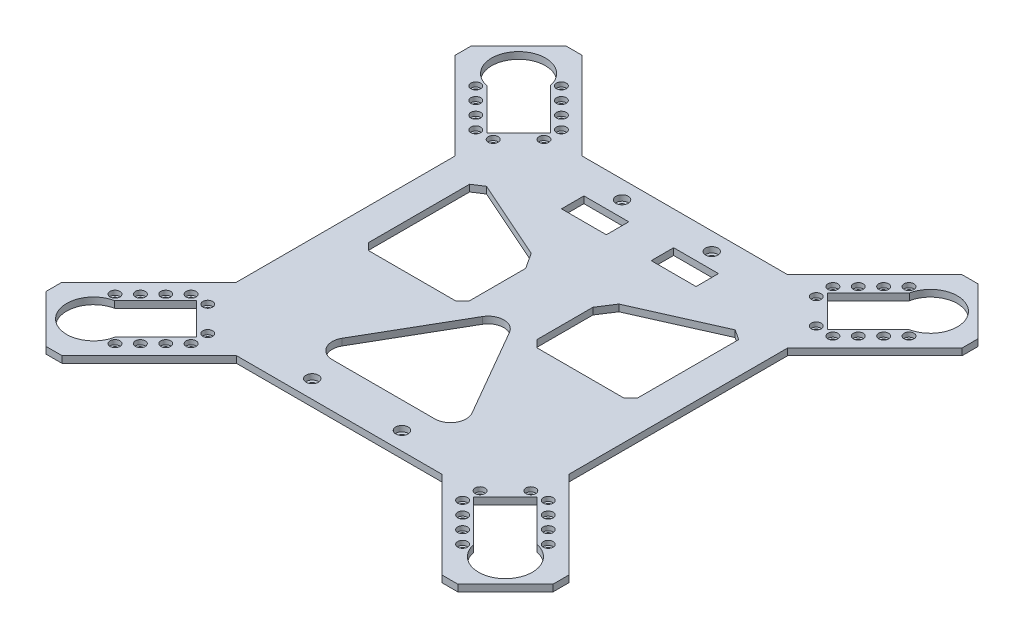
from build123d import *

# Parameters (mm, degrees)
BOSS_EXTRUDE1_DEPTH              = 3
CUT_EXTRUDE1_DEPTH               = 10
CUT_EXTRUDE2_DEPTH               = 10
CBORE_FOR_M2_SHCS1_D             = 2.4
CBORE_FOR_M2_SHCS1_CBORE_D       = 4.4
CBORE_FOR_M2_SHCS1_CBORE_DEPTH   = 2
MIRROR2_COPY_1_D                 = 2.4
MIRROR2_COPY_1_CBORE_D           = 4.4
MIRROR2_COPY_1_CBORE_DEPTH       = 2
SKETCH8_W                        = 20
SKETCH8_H                        = 10
SKETCH8_W_2                      = 60
CUT_EXTRUDE3_DEPTH               = 10
CBORE_FOR_M2_5_SHCS1_D           = 2.9
CBORE_FOR_M2_5_SHCS1_CBORE_D     = 5.5
CBORE_FOR_M2_5_SHCS1_CBORE_DEPTH = 2.5
CORTAR_EXTRUIR1_DEPTH            = 848
CORTAR_EXTRUIR1_DEPTH_BACK       = 962
CROQUIS1_W                       = 356.551899134
CROQUIS1_H                       = 194.800027737
CROQUIS3_W                       = 148.284271248
CROQUIS3_H                       = 70
SALIENTE_EXTRUIR3_DEPTH          = 3
SALIENTE_EXTRUIR4_DEPTH          = 3
CORTAR_EXTRUIR3_DEPTH            = 3
CROQUIS10_R                      = 1.2
CORTAR_EXTRUIR13_DEPTH           = 3
CROQUIS22_R                      = 2.2
CORTAR_EXTRUIR14_DEPTH           = 2
CORTAR_EXTRUIR16_DEPTH           = 243
CORTAR_EXTRUIR16_DEPTH_BACK      = 68
CROQUIS25_R                      = 1.2
CORTAR_EXTRUIR17_DEPTH           = 3
CROQUIS26_R                      = 1.2
CORTAR_EXTRUIR18_DEPTH           = 3
CROQUIS27_R                      = 2.2
CORTAR_EXTRUIR19_DEPTH           = 2
CROQUIS29_R                      = 1.2
CORTAR_EXTRUIR20_DEPTH           = 3
CROQUIS30_R                      = 2.2
CORTAR_EXTRUIR21_DEPTH           = 2
SALIENTE_EXTRUIR5_DEPTH          = 3
CORTAR_EXTRUIR22_DEPTH           = 3
CROQUIS34_R                      = 1.2
CORTAR_EXTRUIR24_DEPTH           = 3
CROQUIS35_R                      = 2.2
CORTAR_EXTRUIR25_DEPTH           = 2
CROQUIS37_R                      = 1.2
CORTAR_EXTRUIR26_DEPTH           = 3
CROQUIS38_R                      = 2.2
CORTAR_EXTRUIR27_DEPTH           = 2
CROQUIS39_R                      = 1.2
CORTAR_EXTRUIR28_DEPTH           = 3
CROQUIS40_R                      = 2.2
CORTAR_EXTRUIR30_DEPTH           = 2
CROQUIS47_R                      = 1.45
CORTAR_EXTRUIR32_DEPTH           = 3
CROQUIS48_R                      = 2.75
CORTAR_EXTRUIR33_DEPTH           = 2.5


with BuildPart() as part:
    # Sketch1 → Boss-Extrude1 (new body)
    with BuildSketch(Plane(origin=(0, 0, 0), x_dir=(1, 0, 0), z_dir=(0, 1, 0))):
        Polygon((-74.142135624, -30), (-74.142135624, -85.857864376), (-113.033008589, -124.748737342), (-113.033008589, -131.819805153), (-91.819805153, -153.033008589), (-84.748737342, -153.033008589), (-45.857864376, -114.142135624), (45.857864376, -114.142135624), (84.748737342, -153.033008589), (91.819805153, -153.033008589), (113.033008589, -131.819805153), (113.033008589, -124.748737342), (74.142135624, -85.857864376), (74.142135624, -30), (90.606601718, -20), (145.606601718, -20), (150.606601718, -15), (150.606601718, 15), (145.606601718, 20), (90.606601718, 20), (74.142135624, 30), (74.142135624, 85.857864376), (113.033008589, 124.748737342), (113.033008589, 131.819805153), (91.819805153, 153.033008589), (84.748737342, 153.033008589), (45.857864376, 114.142135624), (-45.857864376, 114.142135624), (-84.748737342, 153.033008589), (-91.819805153, 153.033008589), (-113.033008589, 131.819805153), (-113.033008589, 124.748737342), (-74.142135624, 85.857864376), (-74.142135624, 30), (-90.606601718, 20), (-145.606601718, 20), (-150.606601718, 15), (-150.606601718, -15), (-145.606601718, -20), (-90.606601718, -20), align=None)
    extrude(amount=BOSS_EXTRUDE1_DEPTH)

    # Sketch2 → Cut-Extrude1 (cut)
    with BuildSketch(Plane(origin=(0, 3, 0), x_dir=(1, 0, 0), z_dir=(0, 1, 0))):
        with BuildLine():
            Line((103.106601718, 10), (128.973352137, 10))
            ThreePointArc((128.973352137, 10), (147.606601718, 0), (128.973352137, -10))
            Line((128.973352137, -10), (103.106601718, -10))
            Line((103.106601718, -10), (103.106601718, 10))
        make_face()
        with BuildLine():
            Line((-103.106601718, -10), (-128.973352137, -10))
            ThreePointArc((-128.973352137, -10), (-147.606601718, 0), (-128.973352137, 10))
            Line((-128.973352137, 10), (-103.106601718, 10))
            Line((-103.106601718, 10), (-103.106601718, -10))
        make_face()
    extrude(amount=-CUT_EXTRUDE1_DEPTH, mode=Mode.SUBTRACT)

    # Sketch4 → Cut-Extrude2 (cut)
    with BuildSketch(Plane(origin=(0, 3, 0), x_dir=(1, 0, 0), z_dir=(0, 1, 0))):
        with BuildLine():
            Line((-75.909902577, 101.767766953), (-61.767766953, 115.909902577))
            Line((-61.767766953, 115.909902577), (-80.058321582, 134.200457205))
            ThreePointArc((-80.058321582, 134.200457205), (-100.305086528, 140.305086528), (-94.200457205, 120.058321582))
            Line((-94.200457205, 120.058321582), (-75.909902577, 101.767766953))
        make_face()
        with BuildLine():
            Line((94.200457205, 120.058321582), (75.909902577, 101.767766953))
            Line((75.909902577, 101.767766953), (61.767766953, 115.909902577))
            Line((61.767766953, 115.909902577), (80.058321582, 134.200457205))
            ThreePointArc((80.058321582, 134.200457205), (100.305086528, 140.305086528), (94.200457205, 120.058321582))
        make_face()
        with BuildLine():
            Line((75.909902577, -101.767766953), (61.767766953, -115.909902577))
            Line((61.767766953, -115.909902577), (80.058321582, -134.200457205))
            ThreePointArc((80.058321582, -134.200457205), (100.305086528, -140.305086528), (94.200457205, -120.058321582))
            Line((94.200457205, -120.058321582), (75.909902577, -101.767766953))
        make_face()
        with BuildLine():
            Line((-94.200457205, -120.058321582), (-75.909902577, -101.767766953))
            Line((-75.909902577, -101.767766953), (-61.767766953, -115.909902577))
            Line((-61.767766953, -115.909902577), (-80.058321582, -134.200457205))
            ThreePointArc((-80.058321582, -134.200457205), (-100.305086528, -140.305086528), (-94.200457205, -120.058321582))
        make_face()
    extrude(amount=-CUT_EXTRUDE2_DEPTH, mode=Mode.SUBTRACT)

    # CBORE for M2 SHCS1 (through all)
    with Locations(Plane(origin=(0, 3, 0), x_dir=(-1, 0, 0), z_dir=(0, 1, 0))):
        with Locations((-104.856601718, -13.5), (-112.856601718, -13.5), (-120.856601718, -13.5), (-128.856601718, -13.5), (-60.530330086, -119.622213178), (-66.187184335, -125.279067427), (-71.844038585, -130.935921677), (-77.500892834, -136.592775926), (-79.622213178, -100.530330086), (-85.279067427, -106.187184335), (-90.935921677, -111.844038585), (-96.592775926, -117.500892834), (-104.856601718, 13.5), (-112.856601718, 13.5), (-120.856601718, 13.5), (-128.856601718, 13.5), (-60.707106781, -112.02081528), (-72.02081528, -100.707106781), (-99.606601718, -8), (-99.606601718, 8)):
            cbore_for_m2_shcs1 = CounterBoreHole(CBORE_FOR_M2_SHCS1_D / 2, CBORE_FOR_M2_SHCS1_CBORE_D / 2, CBORE_FOR_M2_SHCS1_CBORE_DEPTH)

    # Mirror1: CBORE for M2 SHCS1 across plane
    add(cbore_for_m2_shcs1.mirror(Plane(origin=(0, 0, 0), x_dir=(0, 0, 1), z_dir=(1, 0, 0))), mode=Mode.SUBTRACT)

    # Mirror2: CBORE for M2 SHCS1 across plane
    add(cbore_for_m2_shcs1.mirror(Plane.XY), mode=Mode.SUBTRACT)

    # Mirror2 copy 1 (through all)
    with Locations(Plane(origin=(0, 3, 0), x_dir=(1, 0, 0), z_dir=(0, 1, 0))):
        with Locations((-104.856601718, -13.5), (-112.856601718, -13.5), (-120.856601718, -13.5), (-128.856601718, -13.5), (-60.530330086, -119.622213178), (-66.187184335, -125.279067427), (-71.844038585, -130.935921677), (-77.500892834, -136.592775926), (-79.622213178, -100.530330086), (-85.279067427, -106.187184335), (-90.935921677, -111.844038585), (-96.592775926, -117.500892834), (-104.856601718, 13.5), (-112.856601718, 13.5), (-120.856601718, 13.5), (-128.856601718, 13.5), (-60.707106781, -112.02081528), (-72.02081528, -100.707106781), (-99.606601718, -8), (-99.606601718, 8)):
            CounterBoreHole(MIRROR2_COPY_1_D / 2, MIRROR2_COPY_1_CBORE_D / 2, MIRROR2_COPY_1_CBORE_DEPTH)

    # Sketch8 → Cut-Extrude3 (cut)
    with BuildSketch(Plane(origin=(0, 3, 0), x_dir=(1, 0, 0), z_dir=(0, 1, 0))):
        with Locations((20, -94.142135624)):
            Rectangle(SKETCH8_W, SKETCH8_H)
        with Locations((-20, -94.142135624)):
            Rectangle(SKETCH8_W, SKETCH8_H)
        Polygon((-20, -28.162470747), (-55, -28.162470747), (-60, -33.162470747), (-60, -78.162470747), (-55.430942257, -81.131778417), (-19.569057743, -65.193163077), (-15, -58.162470747), (-15, -33.162470747), align=None)
        with Locations((0, -15)):
            Rectangle(SKETCH8_W_2, SKETCH8_H)
        Polygon((55, -28.162470747), (20, -28.162470747), (15, -33.162470747), (15, -58.162470747), (19.569057743, -65.193163077), (55.430942257, -81.131778417), (60, -78.162470747), (60, -33.162470747), align=None)
        Polygon((-20, 28.162470747), (-55, 28.162470747), (-60, 33.162470747), (-60, 78.162470747), (-55.430942257, 81.131778417), (-19.569057743, 65.193163077), (-15, 58.162470747), (-15, 33.162470747), align=None)
        Polygon((20, 28.162470747), (15, 33.162470747), (15, 58.162470747), (19.569057743, 65.193163077), (55.430942257, 81.131778417), (60, 78.162470747), (60, 33.162470747), (55, 28.162470747), align=None)
        with Locations((20, 94.142135624)):
            Rectangle(SKETCH8_W, SKETCH8_H)
        with Locations((-20, 94.142135624)):
            Rectangle(SKETCH8_W, SKETCH8_H)
    extrude(amount=-CUT_EXTRUDE3_DEPTH, mode=Mode.SUBTRACT)

    # CBORE for M2.5 SHCS1 (through all)
    with Locations(Plane(origin=(0, 3, 0), x_dir=(-1, 0, 0), z_dir=(0, 1, 0))):
        with Locations((20, -106.142135624), (-20, -106.142135624), (20, 106.142135624), (-20, 106.142135624)):
            CounterBoreHole(CBORE_FOR_M2_5_SHCS1_D / 2, CBORE_FOR_M2_5_SHCS1_CBORE_D / 2, CBORE_FOR_M2_5_SHCS1_CBORE_DEPTH)

    # Croquis1 → Cortar-Extruir1 (cut, two sides: drawn at the far end of the back side and taken through both)
    with BuildSketch(Plane(origin=(0, 3, 0), x_dir=(-1, 0, 0), z_dir=(0, 1, 0)).offset(-CORTAR_EXTRUIR1_DEPTH_BACK)):
        with Locations((8.604943845, 67.400013869)):
            Rectangle(CROQUIS1_W, CROQUIS1_H)
    extrude(amount=CORTAR_EXTRUIR1_DEPTH + CORTAR_EXTRUIR1_DEPTH_BACK, mode=Mode.SUBTRACT)

    # Croquis3 → Saliente-Extruir3 (add)
    with BuildSketch(Plane(origin=(0, 3, 0), x_dir=(1, 0, 0), z_dir=(0, 1, 0))):
        with Locations((0, -5)):
            Rectangle(CROQUIS3_W, CROQUIS3_H)
    extrude(amount=-SALIENTE_EXTRUIR3_DEPTH)

    # Croquis7 → Saliente-Extruir4 (add)
    with BuildSketch(Plane(origin=(0, 3, 0), x_dir=(-1, 0, 0), z_dir=(0, 1, 0))):
        Polygon((-91.819805152, 78.890872964), (-102.426406871, 68.284271245), (-113.033008589, 57.677669527), (-113.033008589, 50.606601715), (-74.142135624, 11.71572875), (-45.857864376, 40), (-84.74873734, 78.890872964), align=None)
    extrude(amount=-SALIENTE_EXTRUIR4_DEPTH)

    # Croquis9 → Cortar-Extruir3 (cut)
    with BuildSketch(Plane(origin=(0, 3, 0), x_dir=(-1, 0, 0), z_dir=(0, 1, 0))):
        with BuildLine():
            Line((-61.767766953, 41.767766952), (-75.909902577, 27.625631328))
            Line((-75.909902577, 27.625631328), (-94.200457205, 45.916185957))
            ThreePointArc((-94.200457205, 45.916185957), (-100.305086528, 66.162950903), (-80.058321582, 60.05832158))
            Line((-80.058321582, 60.05832158), (-61.767766953, 41.767766952))
        make_face()
    extrude(amount=-CORTAR_EXTRUIR3_DEPTH, mode=Mode.SUBTRACT)

    # Croquis10 → Cortar-Extruir13 (cut)
    with BuildSketch(Plane(origin=(0, 3, 0), x_dir=(-1, 0, 0), z_dir=(0, 1, 0))):
        with Locations((-79.622213179, 26.388194461)):
            Circle(CROQUIS10_R)
        with Locations((-85.279067429, 32.04504871)):
            Circle(CROQUIS10_R)
        with Locations((-90.935921678, 37.70190296)):
            Circle(CROQUIS10_R)
        with Locations((-96.592775928, 43.358757209)):
            Circle(CROQUIS10_R)
    extrude(amount=-CORTAR_EXTRUIR13_DEPTH, mode=Mode.SUBTRACT)

    # Croquis22 → Cortar-Extruir14 (cut)
    with BuildSketch(Plane(origin=(0, 3, 0), x_dir=(-1, 0, 0), z_dir=(0, 1, 0))):
        with Locations((-79.622213179, 26.388194461)):
            Circle(CROQUIS22_R)
        with Locations((-85.279067429, 32.04504871)):
            Circle(CROQUIS22_R)
        with Locations((-90.935921678, 37.70190296)):
            Circle(CROQUIS22_R)
        with Locations((-96.592775928, 43.358757209)):
            Circle(CROQUIS22_R)
    extrude(amount=-CORTAR_EXTRUIR14_DEPTH, mode=Mode.SUBTRACT)

    # Croquis23 → Cortar-Extruir16 (cut, two sides: drawn at the far end of the back side and taken through both)
    with BuildSketch(Plane(origin=(0, 3, 0), x_dir=(-1, 0, 0), z_dir=(0, 1, 0)).offset(-CORTAR_EXTRUIR16_DEPTH_BACK)):
        with BuildLine():
            Line((6.062177826, -29.914518843), (28.937822174, 9.707259422))
            ThreePointArc((28.937822174, 9.707259422), (28.937822174, 16.707259422), (22.875644347, 20.207259422))
            Line((22.875644347, 20.207259422), (-22.875644347, 20.207259422))
            ThreePointArc((-22.875644347, 20.207259422), (-28.937822174, 16.707259422), (-28.937822174, 9.707259422))
            Line((-28.937822174, 9.707259422), (-6.062177826, -29.914518843))
            ThreePointArc((-6.062177826, -29.914518843), (0, -33.414518843), (6.062177826, -29.914518843))
        make_face()
    extrude(amount=CORTAR_EXTRUIR16_DEPTH + CORTAR_EXTRUIR16_DEPTH_BACK, mode=Mode.SUBTRACT)

    # Croquis25 → Cortar-Extruir17 (cut)
    with BuildSketch(Plane(origin=(0, 3, 0), x_dir=(-1, 0, 0), z_dir=(0, 1, 0))):
        with Locations((-60.530330086, 45.480077554)):
            Circle(CROQUIS25_R)
        with Locations((-66.187184335, 51.136931804)):
            Circle(CROQUIS25_R)
        with Locations((-71.844038585, 56.793786053)):
            Circle(CROQUIS25_R)
    extrude(amount=-CORTAR_EXTRUIR17_DEPTH, mode=Mode.SUBTRACT)

    # Croquis26 → Cortar-Extruir18 (cut)
    with BuildSketch(Plane(origin=(0, 3, 0), x_dir=(-1, 0, 0), z_dir=(0, 1, 0))):
        with Locations((-77.500892834, 62.450640303)):
            Circle(CROQUIS26_R)
    extrude(amount=-CORTAR_EXTRUIR18_DEPTH, mode=Mode.SUBTRACT)

    # Croquis27 → Cortar-Extruir19 (cut)
    with BuildSketch(Plane(origin=(0, 3, 0), x_dir=(-1, 0, 0), z_dir=(0, 1, 0))):
        with Locations((-60.530330086, 45.480077554)):
            Circle(CROQUIS27_R)
        with Locations((-66.187184335, 51.136931804)):
            Circle(CROQUIS27_R)
        with Locations((-71.844038585, 56.793786053)):
            Circle(CROQUIS27_R)
        with Locations((-77.500892834, 62.450640303)):
            Circle(CROQUIS27_R)
    extrude(amount=-CORTAR_EXTRUIR19_DEPTH, mode=Mode.SUBTRACT)

    # Croquis29 → Cortar-Extruir20 (cut)
    with BuildSketch(Plane(origin=(0, 3, 0), x_dir=(-1, 0, 0), z_dir=(0, 1, 0))):
        with Locations((-60.707106781, 37.878679656)):
            Circle(CROQUIS29_R)
        with Locations((-72.02081528, 26.564971155)):
            Circle(CROQUIS29_R)
    extrude(amount=-CORTAR_EXTRUIR20_DEPTH, mode=Mode.SUBTRACT)

    # Croquis30 → Cortar-Extruir21 (cut)
    with BuildSketch(Plane(origin=(0, 3, 0), x_dir=(-1, 0, 0), z_dir=(0, 1, 0))):
        with Locations((-60.707106781, 37.878679656)):
            Circle(CROQUIS30_R)
        with Locations((-72.02081528, 26.564971155)):
            Circle(CROQUIS30_R)
    extrude(amount=-CORTAR_EXTRUIR21_DEPTH, mode=Mode.SUBTRACT)

    # Croquis31 → Saliente-Extruir5 (add)
    with BuildSketch(Plane(origin=(0, 3, 0), x_dir=(-1, 0, 0), z_dir=(0, 1, 0))):
        Polygon((74.142135624, 11.715728753), (113.033008589, 50.606601718), (113.033008589, 57.67766953), (91.819805153, 78.890872965), (84.748737342, 78.890872965), (45.857864376, 40), align=None)
    extrude(amount=-SALIENTE_EXTRUIR5_DEPTH)

    # Croquis33 → Cortar-Extruir22 (cut)
    with BuildSketch(Plane(origin=(0, 3, 0), x_dir=(-1, 0, 0), z_dir=(0, 1, 0))):
        with BuildLine():
            Line((61.767766953, 41.767766953), (75.909902577, 27.625631329))
            Line((75.909902577, 27.625631329), (94.200457205, 45.916185958))
            ThreePointArc((94.200457205, 45.916185958), (100.305086528, 66.162950904), (80.058321582, 60.058321582))
            Line((80.058321582, 60.058321582), (61.767766953, 41.767766953))
        make_face()
    extrude(amount=-CORTAR_EXTRUIR22_DEPTH, mode=Mode.SUBTRACT)

    # Croquis34 → Cortar-Extruir24 (cut)
    with BuildSketch(Plane(origin=(0, 3, 0), x_dir=(-1, 0, 0), z_dir=(0, 1, 0))):
        with Locations((60.530330086, 45.480077554)):
            Circle(CROQUIS34_R)
        with Locations((66.187184335, 51.136931804)):
            Circle(CROQUIS34_R)
        with Locations((71.844038585, 56.793786053)):
            Circle(CROQUIS34_R)
        with Locations((77.500892834, 62.450640303)):
            Circle(CROQUIS34_R)
    extrude(amount=-CORTAR_EXTRUIR24_DEPTH, mode=Mode.SUBTRACT)

    # Croquis35 → Cortar-Extruir25 (cut)
    with BuildSketch(Plane(origin=(0, 3, 0), x_dir=(-1, 0, 0), z_dir=(0, 1, 0))):
        with Locations((60.530330086, 45.480077554)):
            Circle(CROQUIS35_R)
        with Locations((66.187184335, 51.136931804)):
            Circle(CROQUIS35_R)
        with Locations((71.844038585, 56.793786053)):
            Circle(CROQUIS35_R)
        with Locations((77.500892834, 62.450640303)):
            Circle(CROQUIS35_R)
    extrude(amount=-CORTAR_EXTRUIR25_DEPTH, mode=Mode.SUBTRACT)

    # Croquis37 → Cortar-Extruir26 (cut)
    with BuildSketch(Plane(origin=(0, 3, 0), x_dir=(-1, 0, 0), z_dir=(0, 1, 0))):
        with Locations((79.622213178, 26.388194461)):
            Circle(CROQUIS37_R)
        with Locations((85.279067427, 32.04504871)):
            Circle(CROQUIS37_R)
        with Locations((90.935921677, 37.70190296)):
            Circle(CROQUIS37_R)
        with Locations((96.592775926, 43.358757209)):
            Circle(CROQUIS37_R)
    extrude(amount=-CORTAR_EXTRUIR26_DEPTH, mode=Mode.SUBTRACT)

    # Croquis38 → Cortar-Extruir27 (cut)
    with BuildSketch(Plane(origin=(0, 3, 0), x_dir=(-1, 0, 0), z_dir=(0, 1, 0))):
        with Locations((79.622213178, 26.388194461)):
            Circle(CROQUIS38_R)
        with Locations((85.279067427, 32.04504871)):
            Circle(CROQUIS38_R)
        with Locations((90.935921677, 37.70190296)):
            Circle(CROQUIS38_R)
        with Locations((96.592775926, 43.358757209)):
            Circle(CROQUIS38_R)
    extrude(amount=-CORTAR_EXTRUIR27_DEPTH, mode=Mode.SUBTRACT)

    # Croquis39 → Cortar-Extruir28 (cut)
    with BuildSketch(Plane(origin=(0, 3, 0), x_dir=(-1, 0, 0), z_dir=(0, 1, 0))):
        with Locations((72.02081528, 26.564971157)):
            Circle(CROQUIS39_R)
        with Locations((60.707106781, 37.878679656)):
            Circle(CROQUIS39_R)
    extrude(amount=-CORTAR_EXTRUIR28_DEPTH, mode=Mode.SUBTRACT)

    # Croquis40 → Cortar-Extruir30 (cut)
    with BuildSketch(Plane(origin=(0, 3, 0), x_dir=(-1, 0, 0), z_dir=(0, 1, 0))):
        with Locations((72.02081528, 26.564971157)):
            Circle(CROQUIS40_R)
        with Locations((60.707106781, 37.878679656)):
            Circle(CROQUIS40_R)
    extrude(amount=-CORTAR_EXTRUIR30_DEPTH, mode=Mode.SUBTRACT)

    # Croquis47 → Cortar-Extruir32 (cut)
    with BuildSketch(Plane(origin=(0, 3, 0), x_dir=(-1, 0, 0), z_dir=(0, 1, 0))):
        with Locations((20, 32)):
            Circle(CROQUIS47_R)
        with Locations((-20, 32)):
            Circle(CROQUIS47_R)
    extrude(amount=-CORTAR_EXTRUIR32_DEPTH, mode=Mode.SUBTRACT)

    # Croquis48 → Cortar-Extruir33 (cut)
    with BuildSketch(Plane(origin=(0, 3, 0), x_dir=(-1, 0, 0), z_dir=(0, 1, 0))):
        with Locations((20, 32)):
            Circle(CROQUIS48_R)
        with Locations((-20, 32)):
            Circle(CROQUIS48_R)
    extrude(amount=-CORTAR_EXTRUIR33_DEPTH, mode=Mode.SUBTRACT)


solid = part.part
